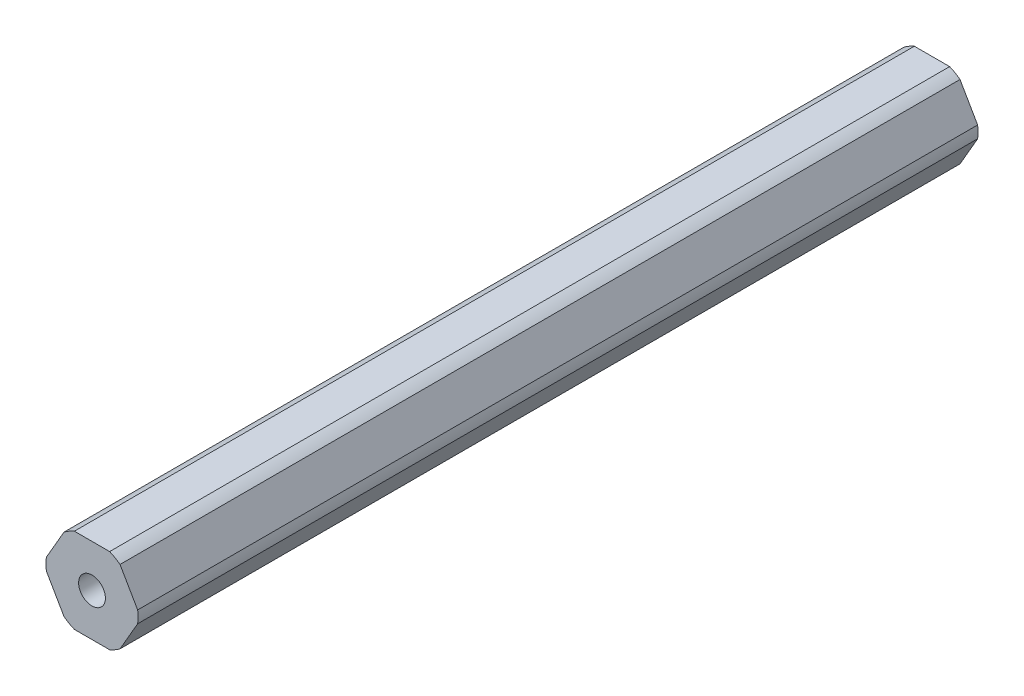
from build123d import *

# Parameters (mm, degrees)
SKETCH1_R           = 2.000000064
BOSS_EXTRUDE1_DEPTH = 62.70625


with BuildPart() as part:
    # Sketch1 → Boss-Extrude1 (new, symmetric)
    with BuildSketch(Plane.XY):
        with BuildLine():
            ThreePointArc((4.181770846, 5.456960429), (3.437499983, 5.953924622), (2.634980936, 6.35))
            Line((2.634980936, 6.35), (-2.634980936, 6.35))
            ThreePointArc((-2.634980936, 6.35), (-3.437499983, 5.953924622), (-4.181770846, 5.456960429))
            Line((-4.181770846, 5.456960429), (-6.816751782, 0.893039571))
            ThreePointArc((-6.816751782, 0.893039571), (-6.874999966, 0), (-6.816751782, -0.893039571))
            Line((-6.816751782, -0.893039571), (-4.181770846, -5.456960429))
            ThreePointArc((-4.181770846, -5.456960429), (-3.437499983, -5.953924622), (-2.634980936, -6.35))
            Line((-2.634980936, -6.35), (2.634980936, -6.35))
            ThreePointArc((2.634980936, -6.35), (3.437499983, -5.953924622), (4.181770846, -5.456960429))
            Line((4.181770846, -5.456960429), (6.816751782, -0.893039571))
            ThreePointArc((6.816751782, -0.893039571), (6.860422465, -0.447468582), (6.874999966, 0))
            ThreePointArc((6.874999966, 0), (6.860422465, 0.447468582), (6.816751782, 0.893039571))
            Line((6.816751782, 0.893039571), (4.181770846, 5.456960429))
        make_face()
        Circle(SKETCH1_R, mode=Mode.SUBTRACT)
    extrude(amount=BOSS_EXTRUDE1_DEPTH, both=True)


solid = part.part
